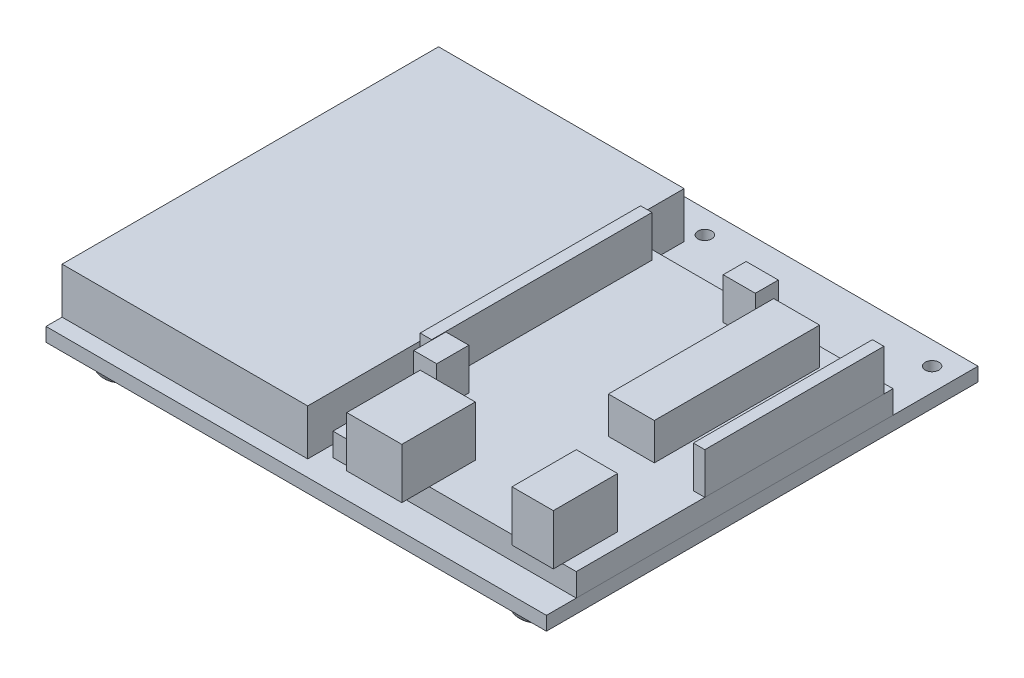
from build123d import *
from OCP.BRepFilletAPI import BRepFilletAPI_MakeChamfer

# Parameters (mm, degrees)
SKETCH1_W             = 109
SKETCH1_H             = 94
SKETCH1_R             = 1.5
BOSS_EXTRUDE1_DEPTH   = 3
SKETCH2_W             = 53.5
SKETCH2_H             = 82
BOSS_EXTRUDE2_DEPTH   = 10
SKETCH2_3_W           = 53
SKETCH2_3_H           = 69
BOSS_EXTRUDE3_DEPTH   = 5
SKETCH3_W             = 2.5
SKETCH3_H             = 39
BOSS_EXTRUDE4_DEPTH   = 9
SKETCH3_W_2           = 7
SKETCH3_H_2           = 5
BOSS_EXTRUDE4_2_DEPTH = 9
SKETCH3_H_3           = 48
BOSS_EXTRUDE4_3_DEPTH = 9
SKETCH3_W_3           = 5
SKETCH3_H_4           = 7
BOSS_EXTRUDE4_4_DEPTH = 9
SKETCH3_3_W           = 10
SKETCH3_3_H           = 36
BOSS_EXTRUDE5_DEPTH   = 8
SKETCH3_4_W           = 12
SKETCH3_4_H           = 10
SKETCH3_4_H_2         = 6
SKETCH3_4_W_2         = 9
SKETCH3_4_H_3         = 12
SKETCH3_4_H_4         = 2
BOSS_EXTRUDE6_DEPTH   = 11
SKETCH4_R             = 5
BOSS_EXTRUDE8_DEPTH   = 5
CHAMFER1_SIZE         = 5
CHAMFER1_SIZE_2       = 0.702704174


# Some blends are built 0.0001 mm under size
with BuildPart() as part:
    # Sketch1 → Boss-Extrude1 (new body)
    with BuildSketch(Plane(origin=(0, 0, 0), x_dir=(1, 0, 0), z_dir=(0, 1, 0))):
        with Locations((54.5, 47)):
            Rectangle(SKETCH1_W, SKETCH1_H)
        with Locations(Location((104, 89, 0), (0, 0, 90))):
            Circle(SKETCH1_R, mode=Mode.SUBTRACT)
        with Locations(Location((5, 89, 0), (0, 0, 270))):
            Circle(SKETCH1_R, mode=Mode.SUBTRACT)
        with Locations(Location((54.5, 89, 0), (0, 0, 270))):
            Circle(SKETCH1_R, mode=Mode.SUBTRACT)
    extrude(amount=BOSS_EXTRUDE1_DEPTH)

    # Sketch4 → Boss-Extrude8 (add)
    with BuildSketch(Plane.XZ):
        with Locations(Location((99.584864983, -7.744460385, 0), (0, 0, 270))):
            Circle(SKETCH4_R)
        with Locations(Location((9.028097361, -7.744460385, 0), (0, 0, 270))):
            Circle(SKETCH4_R)
        with Locations(Location((13.064085197, -82.63875189, 0), (0, 0, 270))):
            Circle(SKETCH4_R)
        with Locations(Location((96.981507832, -82.63875189, 0), (0, 0, 270))):
            Circle(SKETCH4_R)
    extrude(amount=BOSS_EXTRUDE8_DEPTH)

    # Chamfer1
    chamfer1_edges_1 = [part.edges().sort_by_distance(p)[0] for p in [
        (99.584864983, -5, -2.744460385),
    ]]
    chamfer1_side_1 = [part.faces().sort_by_distance(p)[0] for p in [
        (99.584864983, -4.985945917, -2.744460385),
    ]]
    chamfer1_edges_2 = [part.edges().sort_by_distance(p)[0] for p in [
        (9.028097361, -5, -2.744460385),
    ]]
    chamfer1_side_2 = [part.faces().sort_by_distance(p)[0] for p in [
        (9.028097361, -4.985945917, -2.744460385),
    ]]
    chamfer1_edges_3 = [part.edges().sort_by_distance(p)[0] for p in [
        (13.064085197, -5, -77.63875189),
    ]]
    chamfer1_side_3 = [part.faces().sort_by_distance(p)[0] for p in [
        (13.064085197, -4.985945917, -77.63875189),
    ]]
    chamfer1_edges_4 = [part.edges().sort_by_distance(p)[0] for p in [
        (96.981507832, -5, -77.63875189),
    ]]
    chamfer1_side_4 = [part.faces().sort_by_distance(p)[0] for p in [
        (96.981507832, -4.985945917, -77.63875189),
    ]]
    chamfer1 = BRepFilletAPI_MakeChamfer(part.part.solid().wrapped)
    for e in chamfer1_edges_1:
        chamfer1.Add(CHAMFER1_SIZE - 0.0001, CHAMFER1_SIZE_2 - 0.0001, e.wrapped, chamfer1_side_1[0].wrapped)
    for e in chamfer1_edges_2:
        chamfer1.Add(CHAMFER1_SIZE - 0.0001, CHAMFER1_SIZE_2 - 0.0001, e.wrapped, chamfer1_side_2[0].wrapped)
    for e in chamfer1_edges_3:
        chamfer1.Add(CHAMFER1_SIZE - 0.0001, CHAMFER1_SIZE_2 - 0.0001, e.wrapped, chamfer1_side_3[0].wrapped)
    for e in chamfer1_edges_4:
        chamfer1.Add(CHAMFER1_SIZE - 0.0001, CHAMFER1_SIZE_2 - 0.0001, e.wrapped, chamfer1_side_4[0].wrapped)
    add(Compound.cast(chamfer1.Shape()), mode=Mode.REPLACE)  # a hair under: the kernel refuses the full size

    # Fillet1
    # an asymmetric fillet: 3, 2 mm, written as the material it takes off along each edge
    with BuildSketch(Plane(origin=(13.064085197, -5, -82.63875189), x_dir=(0, 0, -1), z_dir=(-1, 0, 0))) as fillet1_piece_1:
        with BuildLine():
            Bezier((4.519778819, -1.582530775), (4.297395826, 0), (1.548967575, 0), weights=[1, 0.754704051, 1])
            Line((1.548967575, 0), (4.297395826, 0))
            Line((4.297395826, 0), (4.519778819, -1.582530775))
        make_face()
    revolve(axis=Axis((13.064085197, -5, -82.63875189), (0, -1, 0)), mode=Mode.SUBTRACT)
    with BuildSketch(Plane(origin=(9.028097361, -5, -7.744460385), x_dir=(0, 0, -1), z_dir=(-1, 0, 0))) as fillet1_piece_2:
        with BuildLine():
            Bezier((4.519778819, -1.582530775), (4.297395826, 0), (1.548967575, 0), weights=[1, 0.754704051, 1])
            Line((1.548967575, 0), (4.297395826, 0))
            Line((4.297395826, 0), (4.519778819, -1.582530775))
        make_face()
    revolve(axis=Axis((9.028097361, -5, -7.744460385), (0, -1, 0)), mode=Mode.SUBTRACT)
    with BuildSketch(Plane(origin=(96.981507832, -5, -82.63875189), x_dir=(0, 0, -1), z_dir=(-1, 0, 0))) as fillet1_piece_3:
        with BuildLine():
            Bezier((4.519778819, -1.582530775), (4.297395826, 0), (1.548967575, 0), weights=[1, 0.754704051, 1])
            Line((1.548967575, 0), (4.297395826, 0))
            Line((4.297395826, 0), (4.519778819, -1.582530775))
        make_face()
    revolve(axis=Axis((96.981507832, -5, -82.63875189), (0, -1, 0)), mode=Mode.SUBTRACT)
    with BuildSketch(Plane(origin=(99.584864983, -5, -7.744460385), x_dir=(0, 0, -1), z_dir=(-1, 0, 0))) as fillet1_piece_4:
        with BuildLine():
            Bezier((4.519778819, -1.582530775), (4.297395826, 0), (1.548967575, 0), weights=[1, 0.754704051, 1])
            Line((1.548967575, 0), (4.297395826, 0))
            Line((4.297395826, 0), (4.519778819, -1.582530775))
        make_face()
    revolve(axis=Axis((99.584864983, -5, -7.744460385), (0, -1, 0)), mode=Mode.SUBTRACT)


with BuildPart() as body_2:
    # Sketch2 → Boss-Extrude2 (new body)
    with BuildSketch(Plane(origin=(0, 3, 0), x_dir=(1, 0, 0), z_dir=(0, 1, 0))):
        with Locations((26.75, 44.5)):
            Rectangle(SKETCH2_W, SKETCH2_H)
    extrude(amount=BOSS_EXTRUDE2_DEPTH)


with BuildPart() as body_3:
    # Sketch2<3> → Boss-Extrude3 (new body)
    with BuildSketch(Plane(origin=(0, 3, 0), x_dir=(1, 0, 0), z_dir=(0, 1, 0))):
        with Locations((82.5, 41)):
            Rectangle(SKETCH2_3_W, SKETCH2_3_H)
    extrude(amount=BOSS_EXTRUDE3_DEPTH)


with BuildPart() as body_4:
    # Sketch3 → Boss-Extrude4 (new body)
    with BuildSketch(Plane(origin=(0, 8, 0), x_dir=(1, 0, 0), z_dir=(0, 1, 0))):
        with Locations((107.75, 54)):
            Rectangle(SKETCH3_W, SKETCH3_H)
    extrude(amount=BOSS_EXTRUDE4_DEPTH)


with BuildPart() as body_5:
    # Sketch3 → Boss-Extrude4 2 (new body)
    with BuildSketch(Plane(origin=(0, 8, 0), x_dir=(1, 0, 0), z_dir=(0, 1, 0))):
        with Locations((81.5, 72)):
            Rectangle(SKETCH3_W_2, SKETCH3_H_2)
    extrude(amount=BOSS_EXTRUDE4_2_DEPTH)


with BuildPart() as body_6:
    # Sketch3 → Boss-Extrude4 3 (new body)
    with BuildSketch(Plane(origin=(0, 8, 0), x_dir=(1, 0, 0), z_dir=(0, 1, 0))):
        with Locations((57.25, 49.5)):
            Rectangle(SKETCH3_W, SKETCH3_H_3)
    extrude(amount=BOSS_EXTRUDE4_3_DEPTH)


with BuildPart() as body_7:
    # Sketch3 → Boss-Extrude4 4 (new body)
    with BuildSketch(Plane(origin=(0, 8, 0), x_dir=(1, 0, 0), z_dir=(0, 1, 0))):
        with Locations((61.1, 25)):
            Rectangle(SKETCH3_W_3, SKETCH3_H_4)
    extrude(amount=BOSS_EXTRUDE4_4_DEPTH)


with BuildPart() as body_8:
    # Sketch3<3> → Boss-Extrude5 (new body)
    with BuildSketch(Plane(origin=(0, 8, 0), x_dir=(1, 0, 0), z_dir=(0, 1, 0))):
        with Locations((92, 53.5)):
            Rectangle(SKETCH3_3_W, SKETCH3_3_H)
    extrude(amount=BOSS_EXTRUDE5_DEPTH)


with BuildPart() as body_9:
    # Sketch3<4> → Boss-Extrude6 (new body)
    with BuildSketch(Plane(origin=(0, 8, 0), x_dir=(1, 0, 0), z_dir=(0, 1, 0))):
        with Locations((71, 11.5)):
            Rectangle(SKETCH3_4_W, SKETCH3_4_H)
        with Locations((71, 3.5)):
            Rectangle(SKETCH3_4_W, SKETCH3_4_H_2)
        with Locations((101.5, 12.5)):
            Rectangle(SKETCH3_4_W_2, SKETCH3_4_H_3)
        with Locations((101.5, 5.5)):
            Rectangle(SKETCH3_4_W_2, SKETCH3_4_H_4)
    extrude(amount=BOSS_EXTRUDE6_DEPTH)


solid = Compound([part.part, body_2.part, body_3.part, body_4.part, body_5.part, body_6.part, body_7.part, body_8.part, body_9.part])
